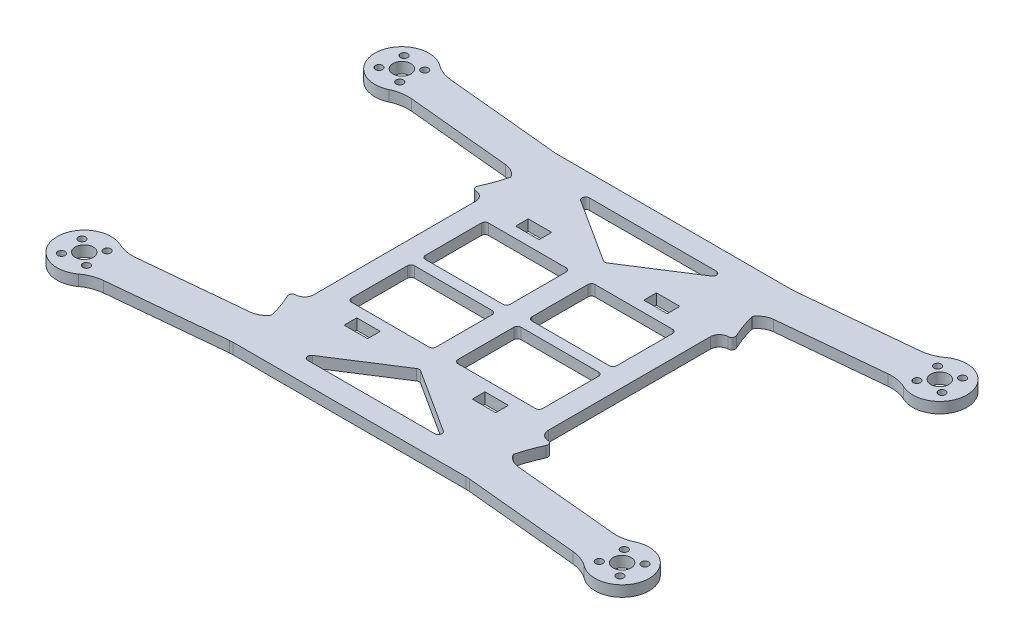
from build123d import *

# Parameters (mm, degrees)
SKETCH1_R           = 2.5
SKETCH1_R_2         = 1
SKETCH1_W           = 6.5
SKETCH1_H           = 3.5
BOSS_EXTRUDE1_DEPTH = 1.5


with BuildPart() as part:
    # Sketch1 → Boss-Extrude1 (new, symmetric)
    with BuildSketch(Plane(origin=(0, 0, 0), x_dir=(1, 0, 0), z_dir=(0, 1, 0))):
        with BuildLine():
            Line((33.208457525, 45.046038016), (65.04658306, 48.11170082))
            ThreePointArc((65.04658306, 48.11170082), (67.67262656, 48.730173936), (70.037768086, 50.028141202))
            ThreePointArc((70.037768086, 50.028141202), (81.965379016, 44.719802857), (71.271715852, 37.230348498))
            ThreePointArc((71.271715852, 37.230348498), (68.703419373, 38.05229444), (66.008879463, 38.158108479))
            Line((66.008879463, 38.158108479), (37.125766182, 35.376980992))
            ThreePointArc((37.125766182, 35.376980992), (35.013218216, 34.675826633), (33.41430611, 33.127292997))
            ThreePointArc((33.41430611, 33.127292997), (34.481402845, 29.690496804), (35.835420758, 26.3562954))
            ThreePointArc((35.835420758, 26.3562954), (35.77253489, 25.409347753), (34.946904251, 24.941374967))
            ThreePointArc((34.946904251, 24.941374967), (33.213559493, 24.190832889), (32.5, 22.441938863))
            Line((32.5, 22.441938863), (32.5, -22.441938863))
            ThreePointArc((32.5, -22.441938863), (33.213559493, -24.190832889), (34.946904251, -24.941374967))
            ThreePointArc((34.946904251, -24.941374967), (35.77253489, -25.409347753), (35.835420758, -26.3562954))
            ThreePointArc((35.835420758, -26.3562954), (34.481402845, -29.690496804), (33.41430611, -33.127292997))
            ThreePointArc((33.41430611, -33.127292997), (35.013218216, -34.675826633), (37.125766182, -35.376980992))
            Line((37.125766182, -35.376980992), (66.008879463, -38.158108479))
            ThreePointArc((66.008879463, -38.158108479), (68.703419373, -38.05229444), (71.271715852, -37.230348498))
            ThreePointArc((71.271715852, -37.230348498), (81.965379016, -44.719802857), (70.037768086, -50.028141202))
            ThreePointArc((70.037768086, -50.028141202), (67.67262656, -48.730173936), (65.04658306, -48.11170082))
            Line((65.04658306, -48.11170082), (33.208457525, -45.046038016))
            ThreePointArc((33.208457525, -45.046038016), (32.729781285, -45.011516135), (32.25, -45))
            Line((32.25, -45), (-32.25, -45))
            ThreePointArc((-32.25, -45), (-32.729781285, -45.011516135), (-33.208457525, -45.046038016))
            Line((-33.208457525, -45.046038016), (-65.04658306, -48.11170082))
            ThreePointArc((-65.04658306, -48.11170082), (-67.67262656, -48.730173936), (-70.037768086, -50.028141202))
            ThreePointArc((-70.037768086, -50.028141202), (-81.965379016, -44.719802857), (-71.271715852, -37.230348498))
            ThreePointArc((-71.271715852, -37.230348498), (-68.703419373, -38.05229444), (-66.008879463, -38.158108479))
            Line((-66.008879463, -38.158108479), (-37.125766182, -35.376980992))
            ThreePointArc((-37.125766182, -35.376980992), (-35.013218216, -34.675826633), (-33.41430611, -33.127292997))
            ThreePointArc((-33.41430611, -33.127292997), (-34.481402845, -29.690496804), (-35.835420758, -26.3562954))
            ThreePointArc((-35.835420758, -26.3562954), (-35.77253489, -25.409347753), (-34.946904251, -24.941374967))
            ThreePointArc((-34.946904251, -24.941374967), (-33.213559493, -24.190832889), (-32.5, -22.441938863))
            Line((-32.5, -22.441938863), (-32.5, 22.441938863))
            ThreePointArc((-32.5, 22.441938863), (-33.213559493, 24.190832889), (-34.946904251, 24.941374967))
            ThreePointArc((-34.946904251, 24.941374967), (-35.77253489, 25.409347753), (-35.835420758, 26.3562954))
            ThreePointArc((-35.835420758, 26.3562954), (-34.481402845, 29.690496804), (-33.41430611, 33.127292997))
            ThreePointArc((-33.41430611, 33.127292997), (-35.013218216, 34.675826633), (-37.125766182, 35.376980992))
            Line((-37.125766182, 35.376980992), (-66.008879463, 38.158108479))
            ThreePointArc((-66.008879463, 38.158108479), (-68.703419373, 38.05229444), (-71.271715852, 37.230348498))
            ThreePointArc((-71.271715852, 37.230348498), (-81.965379016, 44.719802857), (-70.037768086, 50.028141202))
            ThreePointArc((-70.037768086, 50.028141202), (-67.67262656, 48.730173936), (-65.04658306, 48.11170082))
            Line((-65.04658306, 48.11170082), (-33.208457525, 45.046038016))
            ThreePointArc((-33.208457525, 45.046038016), (-32.729781285, 45.011516135), (-32.25, 45))
            Line((-32.25, 45), (32.25, 45))
            ThreePointArc((32.25, 45), (32.729781285, 45.011516135), (33.208457525, 45.046038016))
        make_face()
        with Locations((74.5, 44)):
            Circle(SKETCH1_R, mode=Mode.SUBTRACT)
        with Locations((71.027689375, 46.862351991)):
            Circle(SKETCH1_R_2, mode=Mode.SUBTRACT)
        with Locations((77.362351991, 47.472310625)):
            Circle(SKETCH1_R_2, mode=Mode.SUBTRACT)
        with Locations((77.972310625, 41.137648009)):
            Circle(SKETCH1_R_2, mode=Mode.SUBTRACT)
        with Locations((71.637648009, 40.527689375)):
            Circle(SKETCH1_R_2, mode=Mode.SUBTRACT)
        with Locations((-71.637648009, 40.527689375)):
            Circle(SKETCH1_R_2, mode=Mode.SUBTRACT)
        with Locations((-77.972310625, 41.137648009)):
            Circle(SKETCH1_R_2, mode=Mode.SUBTRACT)
        with Locations((-77.362351991, 47.472310625)):
            Circle(SKETCH1_R_2, mode=Mode.SUBTRACT)
        with Locations((-71.027689375, 46.862351991)):
            Circle(SKETCH1_R_2, mode=Mode.SUBTRACT)
        with Locations((-74.5, 44)):
            Circle(SKETCH1_R, mode=Mode.SUBTRACT)
        with Locations((-74.5, -44)):
            Circle(SKETCH1_R, mode=Mode.SUBTRACT)
        with Locations((-71.027689375, -46.862351991)):
            Circle(SKETCH1_R_2, mode=Mode.SUBTRACT)
        with Locations((-77.362351991, -47.472310625)):
            Circle(SKETCH1_R_2, mode=Mode.SUBTRACT)
        with Locations((-77.972310625, -41.137648009)):
            Circle(SKETCH1_R_2, mode=Mode.SUBTRACT)
        with Locations((-71.637648009, -40.527689375)):
            Circle(SKETCH1_R_2, mode=Mode.SUBTRACT)
        with Locations((71.637648009, -40.527689375)):
            Circle(SKETCH1_R_2, mode=Mode.SUBTRACT)
        with Locations((77.972310625, -41.137648009)):
            Circle(SKETCH1_R_2, mode=Mode.SUBTRACT)
        with Locations((77.362351991, -47.472310625)):
            Circle(SKETCH1_R_2, mode=Mode.SUBTRACT)
        with Locations((71.027689375, -46.862351991)):
            Circle(SKETCH1_R_2, mode=Mode.SUBTRACT)
        with Locations((74.5, -44)):
            Circle(SKETCH1_R, mode=Mode.SUBTRACT)
        with BuildLine():
            Line((0.54024032, 25.859490032), (18.14024032, 37.158489218))
            ThreePointArc((18.14024032, 37.158489218), (18.559559999, 38.28150419), (17.6, 39))
            Line((17.6, 39), (-17.6, 39))
            ThreePointArc((-17.6, 39), (-18.559559999, 38.28150419), (-18.14024032, 37.158489218))
            Line((-18.14024032, 37.158489218), (-0.54024032, 25.859490032))
            ThreePointArc((-0.54024032, 25.859490032), (0, 25.701000814), (0.54024032, 25.859490032))
        make_face(mode=Mode.SUBTRACT)
        with BuildLine():
            Line((4, 1.5), (25.5, 1.5))
            ThreePointArc((25.5, 1.5), (26.207106781, 1.792893219), (26.5, 2.5))
            Line((26.5, 2.5), (26.5, 18))
            ThreePointArc((26.5, 18), (26.207106781, 18.707106781), (25.5, 19))
            Line((25.5, 19), (4, 19))
            ThreePointArc((4, 19), (3.292893219, 18.707106781), (3, 18))
            Line((3, 18), (3, 2.5))
            ThreePointArc((3, 2.5), (3.292893219, 1.792893219), (4, 1.5))
        make_face(mode=Mode.SUBTRACT)
        with Locations((17.75, 23.75)):
            Rectangle(SKETCH1_W, SKETCH1_H, mode=Mode.SUBTRACT)
        with Locations((-17.75, 23.75)):
            Rectangle(SKETCH1_W, SKETCH1_H, mode=Mode.SUBTRACT)
        with BuildLine():
            Line((-26.5, 2.5), (-26.5, 18))
            ThreePointArc((-26.5, 18), (-26.207106781, 18.707106781), (-25.5, 19))
            Line((-25.5, 19), (-4, 19))
            ThreePointArc((-4, 19), (-3.292893219, 18.707106781), (-3, 18))
            Line((-3, 18), (-3, 2.5))
            ThreePointArc((-3, 2.5), (-3.292893219, 1.792893219), (-4, 1.5))
            Line((-4, 1.5), (-25.5, 1.5))
            ThreePointArc((-25.5, 1.5), (-26.207106781, 1.792893219), (-26.5, 2.5))
        make_face(mode=Mode.SUBTRACT)
        with BuildLine():
            Line((-4, -1.5), (-25.5, -1.5))
            ThreePointArc((-25.5, -1.5), (-26.207106781, -1.792893219), (-26.5, -2.5))
            Line((-26.5, -2.5), (-26.5, -18))
            ThreePointArc((-26.5, -18), (-26.207106781, -18.707106781), (-25.5, -19))
            Line((-25.5, -19), (-4, -19))
            ThreePointArc((-4, -19), (-3.292893219, -18.707106781), (-3, -18))
            Line((-3, -18), (-3, -2.5))
            ThreePointArc((-3, -2.5), (-3.292893219, -1.792893219), (-4, -1.5))
        make_face(mode=Mode.SUBTRACT)
        with Locations((-17.75, -23.75)):
            Rectangle(SKETCH1_W, SKETCH1_H, mode=Mode.SUBTRACT)
        with BuildLine():
            Line((-18.14024032, -37.158489218), (-0.54024032, -25.859490032))
            ThreePointArc((-0.54024032, -25.859490032), (0, -25.701000814), (0.54024032, -25.859490032))
            Line((0.54024032, -25.859490032), (18.14024032, -37.158489218))
            ThreePointArc((18.14024032, -37.158489218), (18.559559999, -38.28150419), (17.6, -39))
            Line((17.6, -39), (-17.6, -39))
            ThreePointArc((-17.6, -39), (-18.559559999, -38.28150419), (-18.14024032, -37.158489218))
        make_face(mode=Mode.SUBTRACT)
        with Locations((17.75, -23.75)):
            Rectangle(SKETCH1_W, SKETCH1_H, mode=Mode.SUBTRACT)
        with BuildLine():
            Line((26.5, -2.5), (26.5, -18))
            ThreePointArc((26.5, -18), (26.207106781, -18.707106781), (25.5, -19))
            Line((25.5, -19), (4, -19))
            ThreePointArc((4, -19), (3.292893219, -18.707106781), (3, -18))
            Line((3, -18), (3, -2.5))
            ThreePointArc((3, -2.5), (3.292893219, -1.792893219), (4, -1.5))
            Line((4, -1.5), (25.5, -1.5))
            ThreePointArc((25.5, -1.5), (26.207106781, -1.792893219), (26.5, -2.5))
        make_face(mode=Mode.SUBTRACT)
    extrude(amount=BOSS_EXTRUDE1_DEPTH, both=True)


solid = part.part
